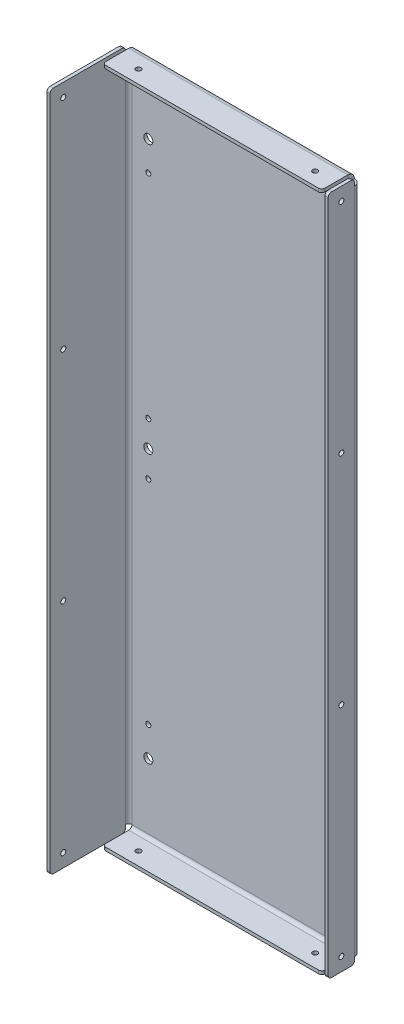
from build123d import *

# Parameters (mm, degrees)
SKETCH1_W                    = 79.375
SKETCH1_H                    = 660.4
BASE_FLANGE1_DEPTH           = 3.175
EDGE_FLANGE1_STRIP_W         = 19.05
EDGE_FLANGE1_STRIP_H         = 3.175
EDGE_FLANGE1_STRIP_CUT_DEPTH = 660.4
EDGE_FLANGE1_DEPTH           = 660.4
EDGE_FLANGE3_STRIP_W         = 19.05
EDGE_FLANGE3_STRIP_H         = 3.175
EDGE_FLANGE3_STRIP_CUT_DEPTH = 660.4
EDGE_FLANGE3_DEPTH           = 660.4
SKETCH21_R                   = 2.45745
CUT_EXTRUDE2_DEPTH           = 703.314018976
SKETCH24_R                   = 2.45745
CUT_EXTRUDE3_DEPTH           = 3.175
SKETCH25_R                   = 4.3688
SKETCH25_R_2                 = 2.45745
CUT_EXTRUDE4_DEPTH           = 3.175
EDGE_FLANGE4_START           = -3.175
EDGE_FLANGE4_DEPTH           = 225.425
EDGE_FLANGE4_2_DEPTH         = 6.35
EDGE_FLANGE4_START_2         = 215.9
EDGE_FLANGE4_3_DEPTH         = 6.35
EDGE_FLANGE4_START_3         = 3.175
EDGE_FLANGE4_4_DEPTH         = 212.725
EDGE_FLANGE5_START           = -3.175
EDGE_FLANGE5_DEPTH           = 225.425
EDGE_FLANGE5_2_DEPTH         = 6.35
EDGE_FLANGE5_START_2         = 215.9
EDGE_FLANGE5_3_DEPTH         = 6.35
EDGE_FLANGE5_START_3         = 3.175
EDGE_FLANGE5_4_DEPTH         = 212.725
SKETCH32_R                   = 2.45745
CUT_EXTRUDE5_DEPTH           = 702.301371113
FILLET1_R                    = 3.175


# Read off the part's stored shape, not the designer's step: Edge-Flange4, Edge-Flange5
# Sheet-metal steps are written as plain solids
with BuildPart() as part:
    # Sketch1 → Base-Flange1 (new body)
    with BuildSketch(Plane(origin=(0, 0, 0), x_dir=(0, 0, -1), z_dir=(1, 0, 0))):
        with Locations((39.6875, 330.2)):
            Rectangle(SKETCH1_W, SKETCH1_H)
    extrude(amount=-BASE_FLANGE1_DEPTH)

    # Edge-Flange1 strip (across the edge) → Edge-Flange1 strip cut (cut)
    with BuildSketch(Plane(origin=(0, 0, -79.375), x_dir=(0, 0, 1), z_dir=(0, 1, 0))):
        with Locations((-3.175, -1.5875)):
            Rectangle(EDGE_FLANGE1_STRIP_W, EDGE_FLANGE1_STRIP_H)
    extrude(amount=EDGE_FLANGE1_STRIP_CUT_DEPTH, mode=Mode.SUBTRACT)

    # Edge-Flange1 section (across the edge) → Edge-Flange1 (add)
    with BuildSketch(Plane(origin=(0, 0, -79.375), x_dir=(0, 0, 1), z_dir=(0, 1, 0))):
        with BuildLine():
            Line((0, 3.175), (0, 222.25))
            Line((0, 222.25), (3.175, 222.25))
            Line((3.175, 222.25), (3.175, 3.175))
            ThreePointArc((3.175, 3.175), (4.10493597, 0.92993597), (6.35, 0))
            Line((6.35, 0), (6.35, -3.175))
            ThreePointArc((6.35, -3.175), (1.859871939, -1.315128061), (0, 3.175))
        make_face()
    extrude(amount=EDGE_FLANGE1_DEPTH)

    # Edge-Flange3 strip (across the edge) → Edge-Flange3 strip cut (cut)
    with BuildSketch(Plane(origin=(222.25, 0, -76.2), x_dir=(-1, 0, 0), z_dir=(0, 1, 0))):
        with Locations((-3.175, -1.5875)):
            Rectangle(EDGE_FLANGE3_STRIP_W, EDGE_FLANGE3_STRIP_H)
    extrude(amount=EDGE_FLANGE3_STRIP_CUT_DEPTH, mode=Mode.SUBTRACT)

    # Edge-Flange3 section (across the edge) → Edge-Flange3 (add)
    with BuildSketch(Plane(origin=(222.25, 0, -76.2), x_dir=(-1, 0, 0), z_dir=(0, 1, 0))):
        with BuildLine():
            Line((0, 3.175), (0, 28.575))
            Line((0, 28.575), (3.175, 28.575))
            Line((3.175, 28.575), (3.175, 3.175))
            ThreePointArc((3.175, 3.175), (4.10493597, 0.92993597), (6.35, 0))
            Line((6.35, 0), (6.35, -3.175))
            ThreePointArc((6.35, -3.175), (1.859871939, -1.315128061), (0, 3.175))
        make_face()
    extrude(amount=EDGE_FLANGE3_DEPTH)

    # Sketch21 → Cut-Extrude2 (cut, through all)
    with BuildSketch(Plane.ZY.offset(3.175)):
        with Locations((-12.7, 647.7)):
            Circle(SKETCH21_R)
        with Locations((-12.7, 436.118)):
            Circle(SKETCH21_R)
        with Locations((-12.7, 224.536)):
            Circle(SKETCH21_R)
        with Locations((-12.7, 12.954)):
            Circle(SKETCH21_R)
    extrude(amount=-CUT_EXTRUDE2_DEPTH, mode=Mode.SUBTRACT)

    # Sketch24 → Cut-Extrude3 (cut)
    with BuildSketch(Plane(origin=(222.25, 0, 0), x_dir=(0, 0, -1), z_dir=(1, 0, 0))):
        with Locations((60.325, 647.7)):
            Circle(SKETCH24_R)
        with Locations((60.325, 436.118)):
            Circle(SKETCH24_R)
        with Locations((60.325, 224.536)):
            Circle(SKETCH24_R)
        with Locations((60.325, 12.954)):
            Circle(SKETCH24_R)
    extrude(amount=-CUT_EXTRUDE3_DEPTH, mode=Mode.SUBTRACT)

    # Sketch25 → Cut-Extrude4 (cut)
    with BuildSketch(Plane(origin=(0, 0, -79.375), x_dir=(-1, 0, 0), z_dir=(0, 0, -1))):
        with Locations((-203.2, 590.55)):
            Circle(SKETCH25_R)
        with Locations((-19.05, 590.55)):
            Circle(SKETCH25_R)
        with Locations((-19.05, 330.2)):
            Circle(SKETCH25_R)
        with Locations((-203.2, 330.2)):
            Circle(SKETCH25_R)
        with Locations((-19.05, 561.975)):
            Circle(SKETCH25_R_2)
        with Locations((-203.2, 561.975)):
            Circle(SKETCH25_R_2)
        with Locations((-203.2, 355.6)):
            Circle(SKETCH25_R_2)
        with Locations((-19.05, 355.6)):
            Circle(SKETCH25_R_2)
        with Locations(Location((-203.2, 304.8, 0), (0, 0, 180))):
            Circle(SKETCH25_R_2)
        with Locations(Location((-19.05, 304.8, 0), (0, 0, 180))):
            Circle(SKETCH25_R_2)
        with Locations(Location((-19.05, 98.425, 0), (0, 0, 180))):
            Circle(SKETCH25_R_2)
        with Locations(Location((-203.2, 98.425, 0), (0, 0, 180))):
            Circle(SKETCH25_R_2)
        with Locations((-203.2, 69.85)):
            Circle(SKETCH25_R)
        with Locations((-19.05, 69.85)):
            Circle(SKETCH25_R)
    extrude(amount=-CUT_EXTRUDE4_DEPTH, mode=Mode.SUBTRACT)

    # Edge-Flange4 outline → Edge-Flange4 (cut)
    with BuildSketch(Plane.YZ.offset(EDGE_FLANGE4_START)):
        with BuildLine():
            ThreePointArc((660.4, -73.025), (658.540128061, -77.515128061), (654.05, -79.375))
            Line((654.05, -79.375), (660.4, -79.375))
            Line((660.4, -79.375), (660.4, -73.025))
        make_face()
        with BuildLine():
            ThreePointArc((654.05, -76.2), (656.29506403, -75.27006403), (657.225, -73.025))
            Line((657.225, -73.025), (654.05, -73.025))
            Line((654.05, -73.025), (654.05, -76.2))
        make_face()
    extrude(amount=EDGE_FLANGE4_DEPTH, mode=Mode.SUBTRACT)

    # Edge-Flange4 2 outline → Edge-Flange4 2 (cut)
    with BuildSketch(Plane.YZ.offset(EDGE_FLANGE4_START)):
        with BuildLine():
            Line((660.4, -73.025), (657.225, -73.025))
            ThreePointArc((657.225, -73.025), (656.29506403, -75.27006403), (654.05, -76.2))
            Line((654.05, -76.2), (654.05, -79.375))
            ThreePointArc((654.05, -79.375), (658.540128061, -77.515128061), (660.4, -73.025))
        make_face()
    extrude(amount=EDGE_FLANGE4_2_DEPTH, mode=Mode.SUBTRACT)

    # Edge-Flange4 3 outline → Edge-Flange4 3 (cut)
    with BuildSketch(Plane.YZ.offset(EDGE_FLANGE4_START_2)):
        with BuildLine():
            Line((660.4, -73.025), (657.225, -73.025))
            ThreePointArc((657.225, -73.025), (656.29506403, -75.27006403), (654.05, -76.2))
            Line((654.05, -76.2), (654.05, -79.375))
            ThreePointArc((654.05, -79.375), (658.540128061, -77.515128061), (660.4, -73.025))
        make_face()
    extrude(amount=EDGE_FLANGE4_3_DEPTH, mode=Mode.SUBTRACT)

    # Edge-Flange4 4 outline → Edge-Flange4 4 (add)
    with BuildSketch(Plane.YZ.offset(EDGE_FLANGE4_START_3)):
        with BuildLine():
            ThreePointArc((659.549261315, -76.2), (660.183628997, -74.668500936), (660.4, -73.025))
            Line((660.4, -73.025), (660.4, -47.625))
            Line((660.4, -47.625), (657.225, -47.625))
            Line((657.225, -47.625), (657.225, -73.025))
            ThreePointArc((657.225, -73.025), (656.29506403, -75.27006403), (654.05, -76.2))
            Line((654.05, -76.2), (659.549261315, -76.2))
        make_face()
    extrude(amount=EDGE_FLANGE4_4_DEPTH)

    # Edge-Flange5 outline → Edge-Flange5 (cut)
    with BuildSketch(Plane.YZ.offset(EDGE_FLANGE5_START)):
        with BuildLine():
            Line((0, -73.025), (0, -79.375))
            Line((0, -79.375), (6.35, -79.375))
            ThreePointArc((6.35, -79.375), (1.859871939, -77.515128061), (0, -73.025))
        make_face()
        with BuildLine():
            Line((6.35, -73.025), (3.175, -73.025))
            ThreePointArc((3.175, -73.025), (4.10493597, -75.27006403), (6.35, -76.2))
            Line((6.35, -76.2), (6.35, -73.025))
        make_face()
    extrude(amount=EDGE_FLANGE5_DEPTH, mode=Mode.SUBTRACT)

    # Edge-Flange5 2 outline → Edge-Flange5 2 (cut)
    with BuildSketch(Plane.YZ.offset(EDGE_FLANGE5_START)):
        with BuildLine():
            Line((3.175, -73.025), (0, -73.025))
            ThreePointArc((0, -73.025), (1.859871939, -77.515128061), (6.35, -79.375))
            Line((6.35, -79.375), (6.35, -76.2))
            ThreePointArc((6.35, -76.2), (4.10493597, -75.27006403), (3.175, -73.025))
        make_face()
    extrude(amount=EDGE_FLANGE5_2_DEPTH, mode=Mode.SUBTRACT)

    # Edge-Flange5 3 outline → Edge-Flange5 3 (cut)
    with BuildSketch(Plane.YZ.offset(EDGE_FLANGE5_START_2)):
        with BuildLine():
            Line((3.175, -73.025), (0, -73.025))
            ThreePointArc((0, -73.025), (1.859871939, -77.515128061), (6.35, -79.375))
            Line((6.35, -79.375), (6.35, -76.2))
            ThreePointArc((6.35, -76.2), (4.10493597, -75.27006403), (3.175, -73.025))
        make_face()
    extrude(amount=EDGE_FLANGE5_3_DEPTH, mode=Mode.SUBTRACT)

    # Edge-Flange5 4 outline → Edge-Flange5 4 (add)
    with BuildSketch(Plane.YZ.offset(EDGE_FLANGE5_START_3)):
        with BuildLine():
            Line((0, -47.625), (0, -73.025))
            ThreePointArc((0, -73.025), (0.216371003, -74.668500936), (0.850738685, -76.2))
            Line((0.850738685, -76.2), (6.35, -76.2))
            ThreePointArc((6.35, -76.2), (4.10493597, -75.27006403), (3.175, -73.025))
            Line((3.175, -73.025), (3.175, -47.625))
            Line((3.175, -47.625), (0, -47.625))
        make_face()
    extrude(amount=EDGE_FLANGE5_4_DEPTH)

    # Sketch32 → Cut-Extrude5 (cut, through all)
    with BuildSketch(Plane.XZ):
        with Locations(Location((25.4, -60.325, 0), (0, 0, 270))):
            Circle(SKETCH32_R)
        with Locations(Location((196.85, -60.325, 0), (0, 0, 270))):
            Circle(SKETCH32_R)
    extrude(amount=-CUT_EXTRUDE5_DEPTH, mode=Mode.SUBTRACT)

    # Fillet1
    fillet1_edges = [part.edges().sort_by_distance(p)[0] for p in [
        (220.6625, 0, -47.625),
        (215.9, 1.5875, -47.625),
        (220.6625, 0, -73.025),
        (-1.5875, 0, 0),
        (3.175, 1.5875, -47.625),
        (-1.5875, 0, -73.025),
        (-1.5875, 660.4, -73.025),
        (-1.5875, 660.4, 0),
        (3.175, 658.8125, -47.625),
        (220.6625, 660.4, -73.025),
        (215.9, 658.8125, -47.625),
        (220.6625, 660.4, -47.625),
    ]]
    fillet(fillet1_edges, radius=FILLET1_R)


solid = part.part
